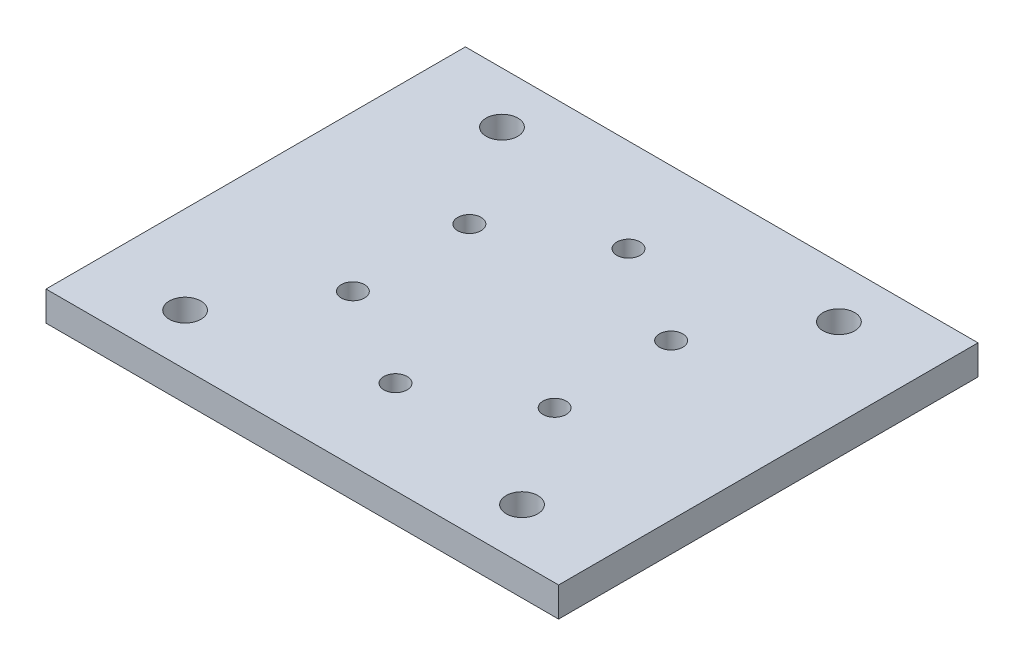
from build123d import *

# Parameters (mm, degrees)
SKETCH2_W            = 110
SKETCH2_H            = 90
BOSS_EXTRUDE1_DEPTH  = 6.35
SKETCH3_R            = 3.4
MOUNTING_HOLES_DEPTH = 143.268487375
SKETCH4_R            = 2.5
CUT_EXTRUDE1_DEPTH   = 143.268487375


with BuildPart() as part:
    # Sketch2 → Boss-Extrude1 (new body)
    with BuildSketch(Plane(origin=(0, 0, 0), x_dir=(1, 0, 0), z_dir=(0, 1, 0))):
        with Locations((55, 45)):
            Rectangle(SKETCH2_W, SKETCH2_H)
    extrude(amount=BOSS_EXTRUDE1_DEPTH)

    # Sketch3 → Mounting Holes (cut, through all)
    with BuildSketch(Plane(origin=(0, 6.35, 0), x_dir=(1, 0, 0), z_dir=(0, 1, 0))):
        with Locations((18.85, 79)):
            Circle(SKETCH3_R)
        with Locations((18.85, 11)):
            Circle(SKETCH3_R)
        with Locations((91.15, 11)):
            Circle(SKETCH3_R)
        with Locations((91.15, 79)):
            Circle(SKETCH3_R)
    extrude(amount=-MOUNTING_HOLES_DEPTH, mode=Mode.SUBTRACT)

    # Sketch4 → Cut-Extrude1 (cut, through all)
    with BuildSketch(Plane(origin=(0, 6.35, 0), x_dir=(1, 0, 0), z_dir=(0, 1, 0))):
        with Locations((55, 70)):
            Circle(SKETCH4_R)
        with Locations((76.650635095, 57.5)):
            Circle(SKETCH4_R)
        with Locations((76.650635095, 32.5)):
            Circle(SKETCH4_R)
        with Locations((55, 20)):
            Circle(SKETCH4_R)
        with Locations((33.349364905, 32.5)):
            Circle(SKETCH4_R)
        with Locations((33.349364905, 57.5)):
            Circle(SKETCH4_R)
    extrude(amount=-CUT_EXTRUDE1_DEPTH, mode=Mode.SUBTRACT)


solid = part.part
